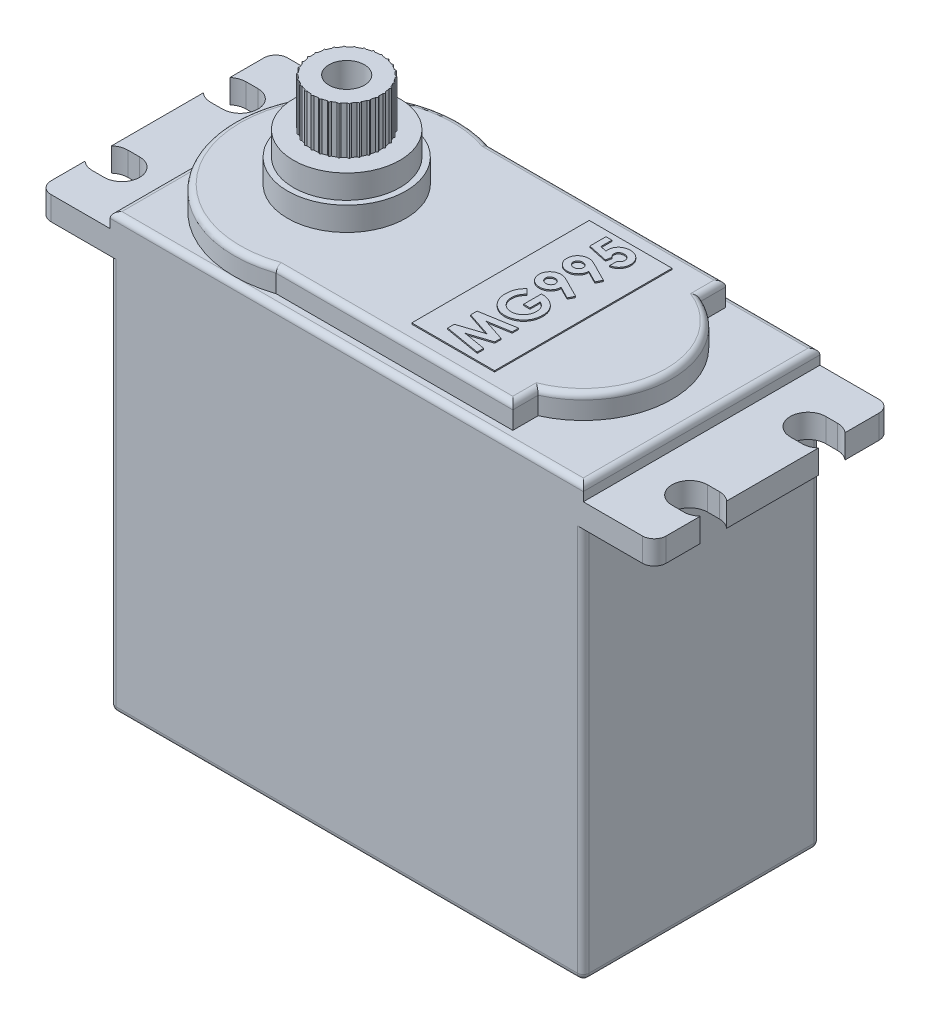
from build123d import *

# Parameters (mm, degrees)
SKETCH1_W       = 40
SKETCH1_H       = 20
EXTRUDE1_DEPTH  = 18.25
EXTRUDE2_DEPTH  = 2
SKETCH3_R       = 5
EXTRUDE3_DEPTH  = 2
SKETCH4_R       = 4.5
EXTRUDE4_DEPTH  = 2
EXTRUDE5_DEPTH  = 4
SKETCH6_R       = 2.9
EXTRUDE6_DEPTH  = 4
EXTRUDE7_DEPTH  = 2
SKETCH8_R       = 1.5
EXTRUDE8_DEPTH  = 10
FILLET4_R       = 0.5
FILLET2_R       = 0.5
FILLET3_R       = 1
SKETCH9_W       = 7
SKETCH9_H       = 15
EXTRUDE9_DEPTH  = 0.1
EXTRUDE10_DEPTH = 0.1
SKETCH12_R      = 1.5
EXTRUDE11_DEPTH = 37


with BuildPart() as part:
    # Sketch1 → Extrude1 (new, symmetric)
    with BuildSketch(Plane(origin=(0, 0, 0), x_dir=(1, 0, 0), z_dir=(0, 1, 0))):
        Rectangle(SKETCH1_W, SKETCH1_H)
    extrude(amount=EXTRUDE1_DEPTH, both=True)

    # Sketch2 → Extrude2 (add)
    with BuildSketch(Plane(origin=(0, 18.25, 0), x_dir=(1, 0, 0), z_dir=(0, 1, 0))):
        with BuildLine():
            Line((13.041381265, -6.8556546), (13.041381265, -9))
            Line((13.041381265, -9), (-6.958618735, -9))
            ThreePointArc((-6.958618735, -9), (-19.5, 0), (-6.958618735, 9))
            Line((-6.958618735, 9), (13.041381265, 9))
            Line((13.041381265, 9), (13.041381265, 6.8556546))
            ThreePointArc((13.041381265, 6.8556546), (17.5, 0), (13.041381265, -6.8556546))
        make_face()
    extrude(amount=EXTRUDE2_DEPTH)

    # Sketch3 → Extrude3 (add)
    with BuildSketch(Plane(origin=(0, 20.25, 0), x_dir=(1, 0, 0), z_dir=(0, 1, 0))):
        with Locations(Location((-10, 0, 0), (0, 0, 270))):
            Circle(SKETCH3_R)
    extrude(amount=EXTRUDE3_DEPTH)

    # Sketch4 → Extrude4 (add)
    with BuildSketch(Plane(origin=(0, 22.25, 0), x_dir=(1, 0, 0), z_dir=(0, 1, 0))):
        with Locations(Location((-10, 0, 0), (0, 0, 270))):
            Circle(SKETCH4_R)
    extrude(amount=EXTRUDE4_DEPTH)

    # Sketch5 → Extrude5 (add)
    with BuildSketch(Plane(origin=(0, 24.25, 0), x_dir=(1, 0, 0), z_dir=(0, 1, 0))):
        with BuildLine():
            Line((-10, 3), (-10.125, 2.897304782))
            ThreePointArc((-10.125, 2.897304782), (-10, 2.9), (-9.875, 2.897304782))
            Line((-9.875, 2.897304782), (-10, 3))
        make_face()
        with BuildLine():
            Line((-9.376264928, 2.934442802), (-9.519884914, 2.859980682))
            ThreePointArc((-9.519884914, 2.859980682), (-9.397056097, 2.836628042), (-9.275348014, 2.80800276))
            Line((-9.275348014, 2.80800276), (-9.376264928, 2.934442802))
        make_face()
        with BuildLine():
            Line((-8.779790071, 2.740636373), (-8.935753161, 2.697661703))
            ThreePointArc((-8.935753161, 2.697661703), (-8.820463735, 2.649281827), (-8.707366797, 2.595977543))
            Line((-8.707366797, 2.595977543), (-8.779790071, 2.740636373))
        make_face()
        with BuildLine():
            Line((-8.236644243, 2.427050983), (-8.398134102, 2.417441963))
            ThreePointArc((-8.398134102, 2.417441963), (-8.295422768, 2.346149284), (-8.195879853, 2.27049565))
            Line((-8.195879853, 2.27049565), (-8.236644243, 2.427050983))
        make_face()
        with BuildLine():
            Line((-7.770565524, 2.007391819), (-7.930524269, 2.031568409))
            ThreePointArc((-7.930524269, 2.031568409), (-7.844880006, 1.940478758), (-7.763241618, 1.845782202))
            Line((-7.763241618, 1.845782202), (-7.770565524, 2.007391819))
        make_face()
        with BuildLine():
            Line((-7.401923789, 1.5), (-7.553360456, 1.556905566))
            ThreePointArc((-7.553360456, 1.556905566), (-7.488526329, 1.45), (-7.428360456, 1.340399216))
            Line((-7.428360456, 1.340399216), (-7.401923789, 1.5))
        make_face()
        with BuildLine():
            Line((-7.146830451, 0.927050983), (-7.283126532, 1.01419848))
            ThreePointArc((-7.283126532, 1.01419848), (-7.241936103, 0.896149284), (-7.205872283, 0.776434351))
            Line((-7.205872283, 0.776434351), (-7.146830451, 0.927050983))
        make_face()
        with BuildLine():
            Line((-7.016434314, 0.31358539), (-7.131633015, 0.427166053))
            ThreePointArc((-7.131633015, 0.427166053), (-7.115886503, 0.303132543), (-7.105500899, 0.17853558))
            Line((-7.105500899, 0.17853558), (-7.016434314, 0.31358539))
        make_face()
        with BuildLine():
            Line((-7.016434314, -0.31358539), (-7.105500899, -0.17853558))
            ThreePointArc((-7.105500899, -0.17853558), (-7.115886503, -0.303132543), (-7.131633015, -0.427166053))
            Line((-7.131633015, -0.427166053), (-7.016434314, -0.31358539))
        make_face()
        with BuildLine():
            Line((-7.146830451, -0.927050983), (-7.205872283, -0.776434351))
            ThreePointArc((-7.205872283, -0.776434351), (-7.241936103, -0.896149284), (-7.283126532, -1.01419848))
            Line((-7.283126532, -1.01419848), (-7.146830451, -0.927050983))
        make_face()
        with BuildLine():
            Line((-7.401923789, -1.5), (-7.428360456, -1.340399216))
            ThreePointArc((-7.428360456, -1.340399216), (-7.488526329, -1.45), (-7.553360456, -1.556905566))
            Line((-7.553360456, -1.556905566), (-7.401923789, -1.5))
        make_face()
        with BuildLine():
            Line((-7.770565524, -2.007391819), (-7.763241618, -1.845782202))
            ThreePointArc((-7.763241618, -1.845782202), (-7.844880006, -1.940478758), (-7.930524269, -2.031568409))
            Line((-7.930524269, -2.031568409), (-7.770565524, -2.007391819))
        make_face()
        with BuildLine():
            Line((-8.236644243, -2.427050983), (-8.195879853, -2.27049565))
            ThreePointArc((-8.195879853, -2.27049565), (-8.295422768, -2.346149284), (-8.398134102, -2.417441963))
            Line((-8.398134102, -2.417441963), (-8.236644243, -2.427050983))
        make_face()
        with BuildLine():
            Line((-8.779790071, -2.740636373), (-8.707366797, -2.595977543))
            ThreePointArc((-8.707366797, -2.595977543), (-8.820463735, -2.649281827), (-8.935753161, -2.697661703))
            Line((-8.935753161, -2.697661703), (-8.779790071, -2.740636373))
        make_face()
        with BuildLine():
            Line((-9.376264928, -2.934442802), (-9.275348014, -2.80800276))
            ThreePointArc((-9.275348014, -2.80800276), (-9.397056097, -2.836628042), (-9.519884914, -2.859980682))
            Line((-9.519884914, -2.859980682), (-9.376264928, -2.934442802))
        make_face()
        with BuildLine():
            Line((-10, -3), (-9.875, -2.897304782))
            ThreePointArc((-9.875, -2.897304782), (-10, -2.9), (-10.125, -2.897304782))
            Line((-10.125, -2.897304782), (-10, -3))
        make_face()
        with BuildLine():
            Line((-10.623735072, -2.934442802), (-10.480115086, -2.859980682))
            ThreePointArc((-10.480115086, -2.859980682), (-10.602943903, -2.836628042), (-10.724651986, -2.80800276))
            Line((-10.724651986, -2.80800276), (-10.623735072, -2.934442802))
        make_face()
        with BuildLine():
            Line((-11.220209929, -2.740636373), (-11.064246839, -2.697661703))
            ThreePointArc((-11.064246839, -2.697661703), (-11.179536265, -2.649281827), (-11.292633203, -2.595977543))
            Line((-11.292633203, -2.595977543), (-11.220209929, -2.740636373))
        make_face()
        with BuildLine():
            Line((-11.763355757, -2.427050983), (-11.601865898, -2.417441963))
            ThreePointArc((-11.601865898, -2.417441963), (-11.704577232, -2.346149284), (-11.804120147, -2.27049565))
            Line((-11.804120147, -2.27049565), (-11.763355757, -2.427050983))
        make_face()
        with BuildLine():
            Line((-12.229434476, -2.007391819), (-12.069475731, -2.031568409))
            ThreePointArc((-12.069475731, -2.031568409), (-12.155119994, -1.940478758), (-12.236758382, -1.845782202))
            Line((-12.236758382, -1.845782202), (-12.229434476, -2.007391819))
        make_face()
        with BuildLine():
            Line((-12.598076211, -1.5), (-12.446639544, -1.556905566))
            ThreePointArc((-12.446639544, -1.556905566), (-12.511473671, -1.45), (-12.571639544, -1.340399216))
            Line((-12.571639544, -1.340399216), (-12.598076211, -1.5))
        make_face()
        with BuildLine():
            Line((-12.853169549, -0.927050983), (-12.716873468, -1.01419848))
            ThreePointArc((-12.716873468, -1.01419848), (-12.758063897, -0.896149284), (-12.794127717, -0.776434351))
            Line((-12.794127717, -0.776434351), (-12.853169549, -0.927050983))
        make_face()
        with BuildLine():
            Line((-12.983565686, -0.31358539), (-12.868366985, -0.427166053))
            ThreePointArc((-12.868366985, -0.427166053), (-12.884113497, -0.303132543), (-12.894499101, -0.17853558))
            Line((-12.894499101, -0.17853558), (-12.983565686, -0.31358539))
        make_face()
        with BuildLine():
            Line((-12.983565686, 0.31358539), (-12.894499101, 0.17853558))
            ThreePointArc((-12.894499101, 0.17853558), (-12.884113497, 0.303132543), (-12.868366985, 0.427166053))
            Line((-12.868366985, 0.427166053), (-12.983565686, 0.31358539))
        make_face()
        with BuildLine():
            Line((-12.853169549, 0.927050983), (-12.794127717, 0.776434351))
            ThreePointArc((-12.794127717, 0.776434351), (-12.758063897, 0.896149284), (-12.716873468, 1.01419848))
            Line((-12.716873468, 1.01419848), (-12.853169549, 0.927050983))
        make_face()
        with BuildLine():
            Line((-12.598076211, 1.5), (-12.571639544, 1.340399216))
            ThreePointArc((-12.571639544, 1.340399216), (-12.511473671, 1.45), (-12.446639544, 1.556905566))
            Line((-12.446639544, 1.556905566), (-12.598076211, 1.5))
        make_face()
        with BuildLine():
            Line((-12.229434476, 2.007391819), (-12.236758382, 1.845782202))
            ThreePointArc((-12.236758382, 1.845782202), (-12.155119994, 1.940478758), (-12.069475731, 2.031568409))
            Line((-12.069475731, 2.031568409), (-12.229434476, 2.007391819))
        make_face()
        with BuildLine():
            Line((-11.763355757, 2.427050983), (-11.804120147, 2.27049565))
            ThreePointArc((-11.804120147, 2.27049565), (-11.704577232, 2.346149284), (-11.601865898, 2.417441963))
            Line((-11.601865898, 2.417441963), (-11.763355757, 2.427050983))
        make_face()
        with BuildLine():
            Line((-11.220209929, 2.740636373), (-11.292633203, 2.595977543))
            ThreePointArc((-11.292633203, 2.595977543), (-11.179536265, 2.649281827), (-11.064246839, 2.697661703))
            Line((-11.064246839, 2.697661703), (-11.220209929, 2.740636373))
        make_face()
        with BuildLine():
            Line((-10.623735072, 2.934442802), (-10.724651986, 2.80800276))
            ThreePointArc((-10.724651986, 2.80800276), (-10.602943903, 2.836628042), (-10.480115086, 2.859980682))
            Line((-10.480115086, 2.859980682), (-10.623735072, 2.934442802))
        make_face()
    extrude(amount=EXTRUDE5_DEPTH)

    # Sketch6 → Extrude6 (add)
    with BuildSketch(Plane(origin=(0, 24.25, 0), x_dir=(1, 0, 0), z_dir=(0, 1, 0))):
        with Locations((-10, 0)):
            Circle(SKETCH6_R)
    extrude(amount=EXTRUDE6_DEPTH)

    # Sketch7 → Extrude7 (add)
    with BuildSketch(Plane(origin=(0, 15, 0), x_dir=(-1, 0, 0), z_dir=(0, 1, 0))):
        with BuildLine():
            Line((20, 10), (26, 10))
            Line((26, 10), (26, 6.118033989))
            ThreePointArc((26, 6.118033989), (25.535233135, 6.401258538), (25, 6.5))
            Line((25, 6.5), (24, 6.5))
            ThreePointArc((24, 6.5), (22.5, 5), (24, 3.5))
            Line((24, 3.5), (25, 3.5))
            ThreePointArc((25, 3.5), (25.535233135, 3.598741462), (26, 3.881966011))
            Line((26, 3.881966011), (26, -3.881966011))
            ThreePointArc((26, -3.881966011), (25.535233135, -3.598741462), (25, -3.5))
            Line((25, -3.5), (24, -3.5))
            ThreePointArc((24, -3.5), (22.5, -5), (24, -6.5))
            Line((24, -6.5), (25, -6.5))
            ThreePointArc((25, -6.5), (25.535233135, -6.401258538), (26, -6.118033989))
            Line((26, -6.118033989), (26, -10))
            Line((26, -10), (20, -10))
            Line((20, -10), (20, 10))
        make_face()
        with BuildLine():
            Line((-24, -3.5), (-25, -3.5))
            ThreePointArc((-25, -3.5), (-25.535233135, -3.598741462), (-26, -3.881966011))
            Line((-26, -3.881966011), (-26, 3.881966011))
            ThreePointArc((-26, 3.881966011), (-25.535233135, 3.598741462), (-25, 3.5))
            Line((-25, 3.5), (-24, 3.5))
            ThreePointArc((-24, 3.5), (-22.5, 5), (-24, 6.5))
            Line((-24, 6.5), (-25, 6.5))
            ThreePointArc((-25, 6.5), (-25.535233135, 6.401258538), (-26, 6.118033989))
            Line((-26, 6.118033989), (-26, 10))
            Line((-26, 10), (-20, 10))
            Line((-20, 10), (-20, -10))
            Line((-20, -10), (-26, -10))
            Line((-26, -10), (-26, -6.118033989))
            ThreePointArc((-26, -6.118033989), (-25.535233135, -6.401258538), (-25, -6.5))
            Line((-25, -6.5), (-24, -6.5))
            ThreePointArc((-24, -6.5), (-22.5, -5), (-24, -3.5))
        make_face()
    extrude(amount=EXTRUDE7_DEPTH)

    # Sketch8 → Extrude8 (cut)
    with BuildSketch(Plane(origin=(0, 28.25, 0), x_dir=(1, 0, 0), z_dir=(0, 1, 0))):
        with Locations(Location((-10, 0, 0), (0, 0, 270))):
            Circle(SKETCH8_R)
    extrude(amount=-EXTRUDE8_DEPTH, mode=Mode.SUBTRACT)

    # Fillet4
    fillet4_edges = [part.edges().sort_by_distance(p)[0] for p in [
        (-19.5, 20.25, 0),
        (3.041381265, 20.25, 9),
        (13.041381265, 20.25, 7.9278273),
        (17.5, 20.25, 0),
        (13.041381265, 20.25, -7.9278273),
        (3.041381265, 20.25, -9),
    ]]
    fillet(fillet4_edges, radius=FILLET4_R)

    # Fillet2
    fillet2_edges = [part.edges().sort_by_distance(p)[0] for p in [
        (-20, 18.25, 0),
        (20, 18.25, 0),
        (0, 18.25, -10),
        (0, 18.25, 10),
        (20, -1.625, 10),
        (-20, -18.25, 0),
        (0, -18.25, 10),
        (-20, -1.625, 10),
        (20, -18.25, 0),
        (20, -1.625, -10),
        (0, -18.25, -10),
        (-20, -1.625, -10),
    ]]
    fillet(fillet2_edges, radius=FILLET2_R - 0.0001)  # a hair under: the kernel refuses the full size

    # Fillet3
    fillet3_edges = [part.edges().sort_by_distance(p)[0] for p in [
        (26, 16, 10),
        (26, 16, -10),
        (-26, 16, -10),
        (-26, 16, 10),
    ]]
    fillet(fillet3_edges, radius=FILLET3_R)

    # Sketch9 → Extrude9 (add)
    with BuildSketch(Plane(origin=(0, 20.25, 0), x_dir=(1, 0, 0), z_dir=(0, 1, 0))):
        with Locations((6.5, 0)):
            Rectangle(SKETCH9_W, SKETCH9_H)
    extrude(amount=EXTRUDE9_DEPTH)

    # Sketch10 → Extrude10 (add)
    # profile 1 of 5: a face of its own
    with BuildSketch(Plane(origin=(0, 20.35, 0), x_dir=(1, 0, 0), z_dir=(0, 1, 0))):
        Polygon((5, -6.462620192), (5, -5.903725962), (7.092548077, -5.219230769), (5, -4.529927885), (5, -3.976442308), (8, -3.469230769), (8, -4.014302885), (6.105168269, -4.334615385), (8, -4.958413462), (8, -5.483653846), (6.105168269, -6.103846154), (8, -6.423557692), (8, -6.969230769), align=None)
    # profile 2 of 5: a face of its own
    with BuildSketch(Plane(origin=(0, 20.35, 0), x_dir=(1, 0, 0), z_dir=(0, 1, 0))):
        with BuildLine():
            Line((5.477163462, -0.219831731), (5.8671875, -0.627283654))
            add(Edge.make_bspline(
                [(5.8671875, -0.627283654), (5.834890169, -0.659542334), (5.771517473, -0.722839189), (5.689033553, -0.826353278), (5.618905916, -0.933562458), (5.561242067, -1.044819598), (5.516512972, -1.160279681), (5.484516819, -1.279714853), (5.465539359, -1.40331942), (5.462882579, -1.486994195), (5.461538462, -1.529326923)],
                knots=[0, 0, 0, 0, 1.075575784, 2.110457258, 3.113929901, 4.09197124, 5.059417775, 6.02750972, 7.002078037, 8, 8, 8, 8], degree=3))
            add(Edge.make_bspline(
                [(5.461538462, -1.529326923), (5.462480279, -1.566028104), (5.464329619, -1.638094091), (5.478373385, -1.743988117), (5.501832861, -1.84517635), (5.534332057, -1.942136823), (5.576623752, -2.034277638), (5.628055356, -2.122132387), (5.689019827, -2.205161497), (5.758363376, -2.282707039), (5.834066853, -2.353324464), (5.915116832, -2.414934239), (6.000063142, -2.467663034), (6.089381089, -2.510396108), (6.18241324, -2.543727464), (6.279537669, -2.567033738), (6.380546185, -2.581971747), (6.449466232, -2.583726555), (6.484375, -2.584615385)],
                knots=[0, 0, 0, 0, 1.07501736, 2.110890821, 3.123068569, 4.114115229, 5.101558292, 6.087971832, 7.091606401, 8.114127012, 9.131531654, 10.119863779, 11.092210096, 12.055570724, 13.015277632, 13.98177939, 14.977748899, 16, 16, 16, 16], degree=3))
            add(Edge.make_bspline(
                [(6.484375, -2.584615385), (6.520491041, -2.583784059), (6.591644587, -2.582146235), (6.696065477, -2.566413079), (6.796525888, -2.54217344), (6.892280473, -2.506693088), (6.984640764, -2.46302746), (7.071818302, -2.407652479), (7.155141885, -2.343078842), (7.233170386, -2.269426011), (7.305065611, -2.189298322), (7.367186372, -2.102562888), (7.420450031, -2.011580259), (7.463966314, -1.915776382), (7.496838978, -1.815274512), (7.521139462, -1.710561096), (7.535774743, -1.601055566), (7.537557025, -1.526366491), (7.538461538, -1.488461538)],
                knots=[0, 0, 0, 0, 1.022033888, 2.013546672, 2.983454993, 3.943493592, 4.899972998, 5.871025147, 6.861547676, 7.880838944, 8.905404004, 9.905061033, 10.896427776, 11.886495431, 12.878446209, 13.885654703, 14.926962766, 16, 16, 16, 16], degree=3))
            add(Edge.make_bspline(
                [(7.538461538, -1.488461538), (7.538239061, -1.463804352), (7.537802288, -1.415396808), (7.530712236, -1.34439119), (7.520576181, -1.276384863), (7.507157249, -1.211114457), (7.488167053, -1.149239028), (7.465960356, -1.089901869), (7.439752026, -1.033450642), (7.408637827, -0.980191421), (7.373762612, -0.929331553), (7.333857951, -0.881347098), (7.289823546, -0.83539635), (7.241121455, -0.79201624), (7.187316222, -0.751940987), (7.129396592, -0.713886683), (7.066787747, -0.678289042), (7.022576552, -0.657255336), (7, -0.646514423)],
                knots=[0, 0, 0, 0, 1.109579412, 2.178351274, 3.208885622, 4.204702371, 5.174744997, 6.119429583, 7.05542196, 7.97267548, 8.893247984, 9.828544973, 10.778894627, 11.756245826, 12.760884819, 13.796418446, 14.874735809, 16, 16, 16, 16], degree=3))
            Line((7, -0.646514423), (7, -1.507692308))
            Line((7, -1.507692308), (6.461538462, -1.507692308))
            Line((6.461538462, -1.507692308), (6.461538462, -0.011899038))
            Line((6.461538462, -0.011899038), (6.589543269, -0.007692308))
            add(Edge.make_bspline(
                [(6.589543269, -0.007692308), (6.622418152, -0.008232841), (6.688109248, -0.009312944), (6.785912101, -0.019183948), (6.8824178, -0.035535118), (6.977529424, -0.057888727), (7.071713507, -0.085903473), (7.164068242, -0.121630973), (7.255219631, -0.163467916), (7.344781553, -0.210342271), (7.430715134, -0.263019177), (7.512095642, -0.319720578), (7.588722536, -0.379697309), (7.659642227, -0.443943862), (7.724776521, -0.512320272), (7.784946169, -0.584000801), (7.840676404, -0.659010377), (7.889805632, -0.738677628), (7.933607851, -0.821663586), (7.972550433, -0.907963674), (8.004719472, -0.998083071), (8.031307324, -1.091617775), (8.051759407, -1.188611885), (8.065799291, -1.289025868), (8.075335197, -1.392926365), (8.076387385, -1.463399438), (8.076923077, -1.499278846)],
                knots=[0, 0, 0, 0, 1.006947556, 2.012098127, 3.007912615, 4.003802745, 5.003693661, 6.015789779, 7.034654729, 8.075083123, 9.110776623, 10.12033905, 11.112364132, 12.089932562, 13.049221985, 14.003156825, 14.955669239, 15.909347409, 16.867458246, 17.828943829, 18.807340259, 19.796171017, 20.806031855, 21.841452577, 22.901035528, 24, 24, 24, 24], degree=3))
            add(Edge.make_bspline(
                [(8.076923077, -1.499278846), (8.076387648, -1.53755833), (8.075326269, -1.613439685), (8.065601254, -1.725665807), (8.049053449, -1.834497799), (8.02788307, -1.940513411), (7.998735025, -2.042941995), (7.964001841, -2.142658526), (7.922233759, -2.238853521), (7.87503751, -2.332002722), (7.821480618, -2.420879223), (7.762538975, -2.505293535), (7.697823654, -2.584782337), (7.628420589, -2.660160536), (7.552623138, -2.729666776), (7.472888501, -2.795891519), (7.38629208, -2.855625688), (7.295642125, -2.911440399), (7.200973755, -2.961018782), (7.104048491, -3.004404689), (7.005568587, -3.041230783), (6.904862936, -3.070730355), (6.802524895, -3.094099474), (6.69818862, -3.111157955), (6.592126148, -3.120701284), (6.520851251, -3.122281528), (6.484975962, -3.123076923)],
                knots=[0, 0, 0, 0, 1.08412885, 2.149066736, 3.187446822, 4.201211187, 5.20898726, 6.20137506, 7.190057482, 8.177191892, 9.15710824, 10.126769281, 11.090919562, 12.058536462, 13.026153363, 14.001871638, 14.991985849, 16.003078977, 17.015762975, 18.016485971, 19.009327865, 19.991410284, 20.986600416, 21.980997625, 22.983761488, 24, 24, 24, 24], degree=3))
            add(Edge.make_bspline(
                [(6.484975962, -3.123076923), (6.436033079, -3.122016101), (6.339385395, -3.119921291), (6.19703654, -3.100446116), (6.05946079, -3.070299839), (5.927038892, -3.026390445), (5.799236995, -2.971035562), (5.67616755, -2.903486605), (5.557988589, -2.823183667), (5.484829304, -2.760994861), (5.447716346, -2.729447115)],
                knots=[0, 0, 0, 0, 1.034063014, 2.041967874, 3.031271063, 4.007437694, 4.986016733, 5.971461028, 6.970942901, 8, 8, 8, 8], degree=3))
            add(Edge.make_bspline(
                [(5.447716346, -2.729447115), (5.426244848, -2.709860793), (5.383624248, -2.670982237), (5.324402058, -2.608834937), (5.268731007, -2.545111563), (5.217791567, -2.478929538), (5.170468648, -2.410636767), (5.127649356, -2.340036693), (5.087970303, -2.267499667), (5.053457651, -2.192459987), (5.022514179, -2.115310498), (4.996331651, -2.035709515), (4.973140154, -1.954253235), (4.955497374, -1.870220358), (4.940805812, -1.784459818), (4.930958758, -1.696362858), (4.923741569, -1.606169546), (4.923300224, -1.545167327), (4.923076923, -1.514302885)],
                knots=[0, 0, 0, 0, 1.020590567, 2.025856924, 3.013483481, 3.991664875, 4.957826714, 5.930500614, 6.890802512, 7.860442893, 8.829981142, 9.809047939, 10.802672283, 11.803273349, 12.823572789, 13.857849586, 14.916166035, 16, 16, 16, 16], degree=3))
            add(Edge.make_bspline(
                [(4.923076923, -1.514302885), (4.92357448, -1.482039522), (4.924564434, -1.417847277), (4.931414276, -1.322404039), (4.941981966, -1.228287049), (4.957834106, -1.135892925), (4.977383093, -1.044911592), (5.002430185, -0.955813991), (5.030888192, -0.86801887), (5.053577018, -0.810864579), (5.064903846, -0.782331731)],
                knots=[0, 0, 0, 0, 1.03180557, 2.052914215, 3.058998889, 4.059601663, 5.049854447, 6.033765722, 7.018406786, 8, 8, 8, 8], degree=3))
            add(Edge.make_bspline(
                [(5.064903846, -0.782331731), (5.075368368, -0.758322373), (5.096652916, -0.709488004), (5.135662346, -0.638486759), (5.178688124, -0.567018989), (5.228544771, -0.497022103), (5.282402782, -0.426469272), (5.34213138, -0.356800091), (5.407180876, -0.287491802), (5.453533825, -0.24267717), (5.477163462, -0.219831731)],
                knots=[0, 0, 0, 0, 0.894422958, 1.819231551, 2.765348375, 3.743239639, 4.753552307, 5.797344382, 6.877138289, 8, 8, 8, 8], degree=3))
        make_face()
    # profile 3 of 5: a face of its own
    with BuildSketch(Plane(origin=(0, 20.35, 0), x_dir=(1, 0, 0), z_dir=(0, 1, 0))):
        with BuildLine():
            Line((8.076923077, 1.273557692), (7.836538462, 0.796394231))
            Line((7.836538462, 0.796394231), (6.807692308, 1.319230769))
            add(Edge.make_bspline(
                [(6.807692308, 1.319230769), (6.806904893, 1.288340434), (6.805359009, 1.227695231), (6.792514539, 1.138399091), (6.77058362, 1.05301048), (6.741403792, 0.970508074), (6.7022263, 0.892088045), (6.655622418, 0.816484106), (6.598774253, 0.745670332), (6.535829131, 0.677950773), (6.466066913, 0.616693244), (6.391527253, 0.562592597), (6.312927576, 0.516782309), (6.229739707, 0.480007737), (6.142792681, 0.451124831), (6.051745428, 0.429822114), (5.956247741, 0.417903504), (5.891257794, 0.416234342), (5.858173077, 0.415384615)],
                knots=[0, 0, 0, 0, 1.014438208, 1.991587644, 2.955575466, 3.906834206, 4.860343588, 5.829907848, 6.818577787, 7.838125475, 8.863876483, 9.862937823, 10.859547262, 11.846397878, 12.845242478, 13.865236027, 14.913246352, 16, 16, 16, 16], degree=3))
            add(Edge.make_bspline(
                [(5.858173077, 0.415384615), (5.826080409, 0.416171185), (5.762842472, 0.417721105), (5.670037043, 0.430618765), (5.580902228, 0.451781936), (5.49541348, 0.481095698), (5.414006105, 0.51926884), (5.336195034, 0.565389301), (5.262277885, 0.620144108), (5.193217941, 0.683083709), (5.129748095, 0.751277631), (5.075121841, 0.824641957), (5.027443903, 0.900354014), (4.989774549, 0.980496447), (4.959158536, 1.06358034), (4.938455881, 1.150748196), (4.925409354, 1.241109449), (4.923860621, 1.302558869), (4.923076923, 1.333653846)],
                knots=[0, 0, 0, 0, 1.055350394, 2.079546115, 3.075301024, 4.065173222, 5.046874257, 6.027823047, 7.036058964, 8.067100199, 9.097720188, 10.095392023, 11.071904115, 12.035727154, 13.002945728, 13.979480054, 14.977565287, 16, 16, 16, 16], degree=3))
            add(Edge.make_bspline(
                [(4.923076923, 1.333653846), (4.923746303, 1.366159974), (4.925062547, 1.430078877), (4.939576993, 1.523650562), (4.96186497, 1.613164653), (4.992065154, 1.699039123), (5.033268674, 1.779911677), (5.081672978, 1.857323272), (5.140288739, 1.929773631), (5.206232368, 1.997634206), (5.278569565, 2.058726244), (5.353663375, 2.113193253), (5.43174517, 2.15949196), (5.512869325, 2.196475272), (5.596478428, 2.22588197), (5.682757437, 2.245919022), (5.771621541, 2.259256681), (5.831881946, 2.260771706), (5.862379808, 2.261538462)],
                knots=[0, 0, 0, 0, 1.062709067, 2.08967359, 3.089490552, 4.078335371, 5.060205664, 6.052952122, 7.060109841, 8.102908433, 9.144326257, 10.153805576, 11.135063239, 12.108674621, 13.066249871, 14.029571809, 15.002763993, 16, 16, 16, 16], degree=3))
            add(Edge.make_bspline(
                [(5.862379808, 2.261538462), (5.885639282, 2.261117347), (5.932489093, 2.260269126), (6.002554224, 2.25203289), (6.072799378, 2.239364726), (6.131967589, 2.224590825), (6.182045054, 2.209730223), (6.224406965, 2.194277681), (6.271611593, 2.175641192), (6.323731584, 2.154070518), (6.380508742, 2.129392356), (6.441745751, 2.100765519), (6.508380958, 2.069998088), (6.553943868, 2.047315725), (6.577524038, 2.035576923)],
                knots=[0, 0, 0, 0, 1.105166677, 2.22605417, 3.348517788, 4.496260522, 5.122810462, 5.830557215, 6.638607343, 7.535109037, 8.511576286, 9.580928918, 10.748058253, 12, 12, 12, 12], degree=3))
            Line((6.577524038, 2.035576923), (8.076923077, 1.273557692))
        make_face()
        with BuildLine():
            add(Edge.make_bspline(
                [(6.307692308, 1.345673077), (6.306175757, 1.371476062), (6.303212759, 1.421889252), (6.28023145, 1.494267952), (6.241024204, 1.559303977), (6.188209211, 1.616352029), (6.124715607, 1.663842091), (6.052575251, 1.698640308), (5.972937038, 1.719737698), (5.917399007, 1.721942467), (5.888822115, 1.723076923)],
                knots=[0, 0, 0, 0, 0.984989413, 1.924446292, 2.868477643, 3.865502828, 4.877610339, 5.88087679, 6.909612885, 8, 8, 8, 8], degree=3))
            add(Edge.make_bspline(
                [(5.888822115, 1.723076923), (5.859647306, 1.721720391), (5.802895335, 1.719081612), (5.721213327, 1.697621218), (5.647377636, 1.660949721), (5.583194086, 1.611060248), (5.529480655, 1.552814938), (5.49024444, 1.48768198), (5.465982022, 1.417242936), (5.463029876, 1.368496654), (5.461538462, 1.343870192)],
                knots=[0, 0, 0, 0, 1.104110315, 2.147758178, 3.172670271, 4.206310416, 5.210906102, 6.157051016, 7.068948237, 8, 8, 8, 8], degree=3))
            add(Edge.make_bspline(
                [(5.461538462, 1.343870192), (5.462995289, 1.317844151), (5.465855757, 1.266742233), (5.490018335, 1.193394217), (5.528596635, 1.126085096), (5.581830904, 1.066414479), (5.645747528, 1.015969521), (5.719819511, 0.980100518), (5.800973985, 0.957618468), (5.85782177, 0.955126201), (5.887019231, 0.953846154)],
                knots=[0, 0, 0, 0, 0.970853505, 1.906262912, 2.855477211, 3.852937491, 4.877462982, 5.878766514, 6.910518104, 8, 8, 8, 8], degree=3))
            add(Edge.make_bspline(
                [(5.887019231, 0.953846154), (5.915806519, 0.955175881), (5.971794789, 0.957762062), (6.051972906, 0.979545349), (6.124823212, 1.014693558), (6.188404532, 1.063719451), (6.241488268, 1.122676073), (6.280239772, 1.190634925), (6.303276968, 1.266095159), (6.306194034, 1.318669607), (6.307692308, 1.345673077)],
                knots=[0, 0, 0, 0, 1.075841396, 2.092399178, 3.084869331, 4.085011737, 5.078048045, 6.03490933, 6.990683323, 8, 8, 8, 8], degree=3))
        make_face(mode=Mode.SUBTRACT)
    # profile 4 of 5: a face of its own
    with BuildSketch(Plane(origin=(0, 20.35, 0), x_dir=(1, 0, 0), z_dir=(0, 1, 0))):
        with BuildLine():
            Line((8.076923077, 3.619711538), (7.836538462, 3.142548077))
            Line((7.836538462, 3.142548077), (6.807692308, 3.665384615))
            add(Edge.make_bspline(
                [(6.807692308, 3.665384615), (6.806904893, 3.63449428), (6.805359009, 3.573849077), (6.792514539, 3.484552937), (6.77058362, 3.399164327), (6.741403792, 3.31666192), (6.7022263, 3.238241892), (6.655622418, 3.162637952), (6.598774253, 3.091824179), (6.535829131, 3.02410462), (6.466066913, 2.96284709), (6.391527253, 2.908746443), (6.312927576, 2.862936155), (6.229739707, 2.826161583), (6.142792681, 2.797278677), (6.051745428, 2.77597596), (5.956247741, 2.76405735), (5.891257794, 2.762388189), (5.858173077, 2.761538462)],
                knots=[0, 0, 0, 0, 1.014438208, 1.991587644, 2.955575466, 3.906834206, 4.860343588, 5.829907848, 6.818577787, 7.838125475, 8.863876483, 9.862937823, 10.859547262, 11.846397878, 12.845242478, 13.865236027, 14.913246352, 16, 16, 16, 16], degree=3))
            add(Edge.make_bspline(
                [(5.858173077, 2.761538462), (5.826080409, 2.762325031), (5.762842472, 2.763874951), (5.670037043, 2.776772611), (5.580902228, 2.797935782), (5.49541348, 2.827249544), (5.414006105, 2.865422686), (5.336195034, 2.911543147), (5.262277885, 2.966297954), (5.193217941, 3.029237555), (5.129748095, 3.097431478), (5.075121841, 3.170795803), (5.027443903, 3.24650786), (4.989774549, 3.326650293), (4.959158536, 3.409734187), (4.938455881, 3.496902042), (4.925409354, 3.587263295), (4.923860621, 3.648712715), (4.923076923, 3.679807692)],
                knots=[0, 0, 0, 0, 1.055350394, 2.079546115, 3.075301024, 4.065173222, 5.046874257, 6.027823047, 7.036058964, 8.067100199, 9.097720188, 10.095392023, 11.071904115, 12.035727154, 13.002945728, 13.979480054, 14.977565287, 16, 16, 16, 16], degree=3))
            add(Edge.make_bspline(
                [(4.923076923, 3.679807692), (4.923746303, 3.71231382), (4.925062547, 3.776232723), (4.939576993, 3.869804408), (4.96186497, 3.959318499), (4.992065154, 4.045192969), (5.033268674, 4.126065523), (5.081672978, 4.203477118), (5.140288739, 4.275927477), (5.206232368, 4.343788052), (5.278569565, 4.40488009), (5.353663375, 4.459347099), (5.43174517, 4.505645806), (5.512869325, 4.542629118), (5.596478428, 4.572035816), (5.682757437, 4.592072868), (5.771621541, 4.605410528), (5.831881946, 4.606925552), (5.862379808, 4.607692308)],
                knots=[0, 0, 0, 0, 1.062709067, 2.08967359, 3.089490552, 4.078335371, 5.060205664, 6.052952122, 7.060109841, 8.102908433, 9.144326257, 10.153805576, 11.135063239, 12.108674621, 13.066249871, 14.029571809, 15.002763993, 16, 16, 16, 16], degree=3))
            add(Edge.make_bspline(
                [(5.862379808, 4.607692308), (5.885639282, 4.607271193), (5.932489093, 4.606422973), (6.002554224, 4.598186737), (6.072799378, 4.585518572), (6.131967589, 4.570744671), (6.182045054, 4.555884069), (6.224406965, 4.540431527), (6.271611593, 4.521795038), (6.323731584, 4.500224364), (6.380508742, 4.475546203), (6.441745751, 4.446919365), (6.508380958, 4.416151934), (6.553943868, 4.393469571), (6.577524038, 4.381730769)],
                knots=[0, 0, 0, 0, 1.105166677, 2.22605417, 3.348517788, 4.496260522, 5.122810462, 5.830557215, 6.638607343, 7.535109037, 8.511576286, 9.580928918, 10.748058253, 12, 12, 12, 12], degree=3))
            Line((6.577524038, 4.381730769), (8.076923077, 3.619711538))
        make_face()
        with BuildLine():
            add(Edge.make_bspline(
                [(6.307692308, 3.691826923), (6.306175757, 3.717629908), (6.303212759, 3.768043098), (6.28023145, 3.840421798), (6.241024204, 3.905457824), (6.188209211, 3.962505875), (6.124715607, 4.009995937), (6.052575251, 4.044794154), (5.972937038, 4.065891544), (5.917399007, 4.068096313), (5.888822115, 4.069230769)],
                knots=[0, 0, 0, 0, 0.984989413, 1.924446292, 2.868477643, 3.865502828, 4.877610339, 5.88087679, 6.909612885, 8, 8, 8, 8], degree=3))
            add(Edge.make_bspline(
                [(5.888822115, 4.069230769), (5.859647306, 4.067874237), (5.802895335, 4.065235458), (5.721213327, 4.043775064), (5.647377636, 4.007103568), (5.583194086, 3.957214094), (5.529480655, 3.898968784), (5.49024444, 3.833835826), (5.465982022, 3.763396782), (5.463029876, 3.7146505), (5.461538462, 3.690024038)],
                knots=[0, 0, 0, 0, 1.104110315, 2.147758178, 3.172670271, 4.206310416, 5.210906102, 6.157051016, 7.068948237, 8, 8, 8, 8], degree=3))
            add(Edge.make_bspline(
                [(5.461538462, 3.690024038), (5.462995289, 3.663997997), (5.465855757, 3.612896079), (5.490018335, 3.539548064), (5.528596635, 3.472238942), (5.581830904, 3.412568325), (5.645747528, 3.362123367), (5.719819511, 3.326254364), (5.800973985, 3.303772314), (5.85782177, 3.301280047), (5.887019231, 3.3)],
                knots=[0, 0, 0, 0, 0.970853505, 1.906262912, 2.855477211, 3.852937491, 4.877462982, 5.878766514, 6.910518104, 8, 8, 8, 8], degree=3))
            add(Edge.make_bspline(
                [(5.887019231, 3.3), (5.915806519, 3.301329727), (5.971794789, 3.303915909), (6.051972906, 3.325699196), (6.124823212, 3.360847405), (6.188404532, 3.409873297), (6.241488268, 3.468829919), (6.280239772, 3.536788772), (6.303276968, 3.612249005), (6.306194034, 3.664823453), (6.307692308, 3.691826923)],
                knots=[0, 0, 0, 0, 1.075841396, 2.092399178, 3.084869331, 4.085011737, 5.078048045, 6.03490933, 6.990683323, 8, 8, 8, 8], degree=3))
        make_face(mode=Mode.SUBTRACT)
    # profile 5 of 5: a face of its own
    with BuildSketch(Plane(origin=(0, 20.35, 0), x_dir=(1, 0, 0), z_dir=(0, 1, 0))):
        with BuildLine():
            Line((5, 5.549399038), (5, 6.915384615))
            Line((5, 6.915384615), (5.5, 6.915384615))
            Line((5.5, 6.915384615), (5.5, 5.976081731))
            Line((5.5, 5.976081731), (6.067307692, 5.858894231))
            add(Edge.make_bspline(
                [(6.067307692, 5.858894231), (6.062860271, 5.874862705), (6.054089041, 5.906355818), (6.045292608, 5.95380023), (6.03959104, 5.999780478), (6.038830526, 6.029952436), (6.038461538, 6.044591346)],
                knots=[0, 0, 0, 0, 1.05461699, 2.079921384, 3.068411212, 4, 4, 4, 4], degree=3))
            add(Edge.make_bspline(
                [(6.038461538, 6.044591346), (6.039192502, 6.076491064), (6.040633392, 6.139372436), (6.05431214, 6.231359903), (6.075855753, 6.319443338), (6.106581391, 6.403353193), (6.146571601, 6.483007502), (6.194948546, 6.558502821), (6.251797193, 6.629931807), (6.317153133, 6.696025581), (6.388915435, 6.756755302), (6.466533958, 6.80955633), (6.548901937, 6.854651703), (6.63653137, 6.890519004), (6.728871886, 6.918828536), (6.825982658, 6.939285635), (6.927978777, 6.95138294), (6.997563437, 6.953014188), (7.033052885, 6.953846154)],
                knots=[0, 0, 0, 0, 1.01440847, 1.999622559, 2.951875003, 3.895578053, 4.836219714, 5.782137149, 6.743708247, 7.735272588, 8.734977101, 9.730283169, 10.717124674, 11.717316708, 12.737475749, 13.78628267, 14.87096371, 16, 16, 16, 16], degree=3))
            add(Edge.make_bspline(
                [(7.033052885, 6.953846154), (7.068944809, 6.952828653), (7.139770068, 6.950820827), (7.243915343, 6.937744064), (7.343635799, 6.914599166), (7.439152923, 6.883082021), (7.529644219, 6.840725314), (7.61678682, 6.791221565), (7.698708974, 6.730980357), (7.77565492, 6.662914335), (7.846031204, 6.58861681), (7.907780555, 6.509312749), (7.960660881, 6.42633308), (8.002601415, 6.338503796), (8.035951006, 6.247168107), (8.060176575, 6.152008967), (8.074080374, 6.052615897), (8.075965097, 5.98513899), (8.076923077, 5.950841346)],
                knots=[0, 0, 0, 0, 1.068214675, 2.107899807, 3.117335077, 4.110871058, 5.095206435, 6.086091645, 7.088956472, 8.115291905, 9.140102477, 10.129911027, 11.102477109, 12.062389472, 13.02046727, 13.992137592, 14.979429371, 16, 16, 16, 16], degree=3))
            add(Edge.make_bspline(
                [(8.076923077, 5.950841346), (8.076113531, 5.920176081), (8.074516938, 5.85969776), (8.06537807, 5.770473947), (8.047228367, 5.684901481), (8.024441941, 5.602136662), (7.993032141, 5.523323775), (7.9569371, 5.446838763), (7.911620463, 5.374984089), (7.86169759, 5.305718395), (7.80500065, 5.241704481), (7.743734191, 5.182269425), (7.676752974, 5.129674091), (7.605358858, 5.081958965), (7.528218768, 5.041716553), (7.446720292, 5.005742169), (7.359946066, 4.976353201), (7.299797643, 4.961429991), (7.269230769, 4.953846154)],
                knots=[0, 0, 0, 0, 1.055144606, 2.080965977, 3.079696235, 4.061281178, 5.030010203, 5.994686618, 6.966205752, 7.947572972, 8.929036963, 9.903776773, 10.879904045, 11.854643856, 12.853445432, 13.868704235, 14.916895142, 16, 16, 16, 16], degree=3))
            Line((7.269230769, 4.953846154), (7.269230769, 5.569230769))
            add(Edge.make_bspline(
                [(7.269230769, 5.569230769), (7.290417984, 5.580476437), (7.331592918, 5.602331109), (7.386174862, 5.643966075), (7.432949461, 5.69025641), (7.471051408, 5.741957315), (7.501244168, 5.797352352), (7.523189801, 5.856161812), (7.536065488, 5.918030464), (7.537657579, 5.960197334), (7.538461538, 5.981490385)],
                knots=[0, 0, 0, 0, 1.10506944, 2.147576346, 3.153981456, 4.13180336, 5.099527609, 6.055753385, 7.01821161, 8, 8, 8, 8], degree=3))
            add(Edge.make_bspline(
                [(7.538461538, 5.981490385), (7.537903222, 5.996329509), (7.536804725, 6.025525736), (7.530993398, 6.06854176), (7.519986878, 6.109602445), (7.504745407, 6.149013067), (7.48573757, 6.186879493), (7.461741415, 6.222658894), (7.43412095, 6.256973769), (7.402426373, 6.289301705), (7.367094293, 6.318581496), (7.329127564, 6.344256671), (7.289369815, 6.367213818), (7.246246142, 6.384218528), (7.201044234, 6.398143947), (7.153423118, 6.408399189), (7.103327176, 6.414527852), (7.069128081, 6.415095203), (7.051682692, 6.415384615)],
                knots=[0, 0, 0, 0, 0.978869489, 1.925942215, 2.855067702, 3.774946051, 4.70828698, 5.642468714, 6.60995405, 7.609372294, 8.622401667, 9.629904756, 10.629323, 11.642352373, 12.678539694, 13.745912462, 14.850161547, 16, 16, 16, 16], degree=3))
            add(Edge.make_bspline(
                [(7.051682692, 6.415384615), (7.03464225, 6.415048719), (7.001472615, 6.414394888), (6.952767714, 6.408986265), (6.906555565, 6.399310349), (6.862482273, 6.386126808), (6.820815272, 6.369250385), (6.781307279, 6.348625962), (6.744155239, 6.324166816), (6.710125753, 6.295736473), (6.678883984, 6.265433673), (6.651662837, 6.232824827), (6.628759394, 6.198525106), (6.610046474, 6.162597971), (6.59454208, 6.125372685), (6.584906086, 6.086009391), (6.577551149, 6.045465708), (6.577134615, 6.017784163), (6.576923077, 6.003725962)],
                knots=[0, 0, 0, 0, 1.166353127, 2.270334681, 3.348811111, 4.394351869, 5.415506664, 6.421447184, 7.440758738, 8.453871, 9.452682422, 10.416618495, 11.356052082, 12.270018172, 13.186757755, 14.10810127, 15.039190426, 16, 16, 16, 16], degree=3))
            add(Edge.make_bspline(
                [(6.576923077, 6.003725962), (6.577486655, 5.988452744), (6.578616186, 5.957841941), (6.588289889, 5.912519821), (6.602607976, 5.867344548), (6.62398733, 5.822903823), (6.651418251, 5.778779696), (6.684559591, 5.734896213), (6.72394107, 5.691430889), (6.75339325, 5.663967374), (6.768629808, 5.649759615)],
                knots=[0, 0, 0, 0, 0.882519632, 1.768758668, 2.670168731, 3.618680561, 4.612333577, 5.671392632, 6.795336641, 8, 8, 8, 8], degree=3))
            Line((6.768629808, 5.649759615), (6.664663462, 5.196634615))
            Line((6.664663462, 5.196634615), (5, 5.549399038))
        make_face()
    extrude(amount=EXTRUDE10_DEPTH)

    # Sketch12 → Extrude11 (add)
    with BuildSketch(Plane(origin=(0, 18.25, 0), x_dir=(1, 0, 0), z_dir=(0, 1, 0))):
        with Locations(Location((-10, 0, 0), (0, 0, 270))):
            Circle(SKETCH12_R)
    extrude(amount=-EXTRUDE11_DEPTH)


solid = part.part
